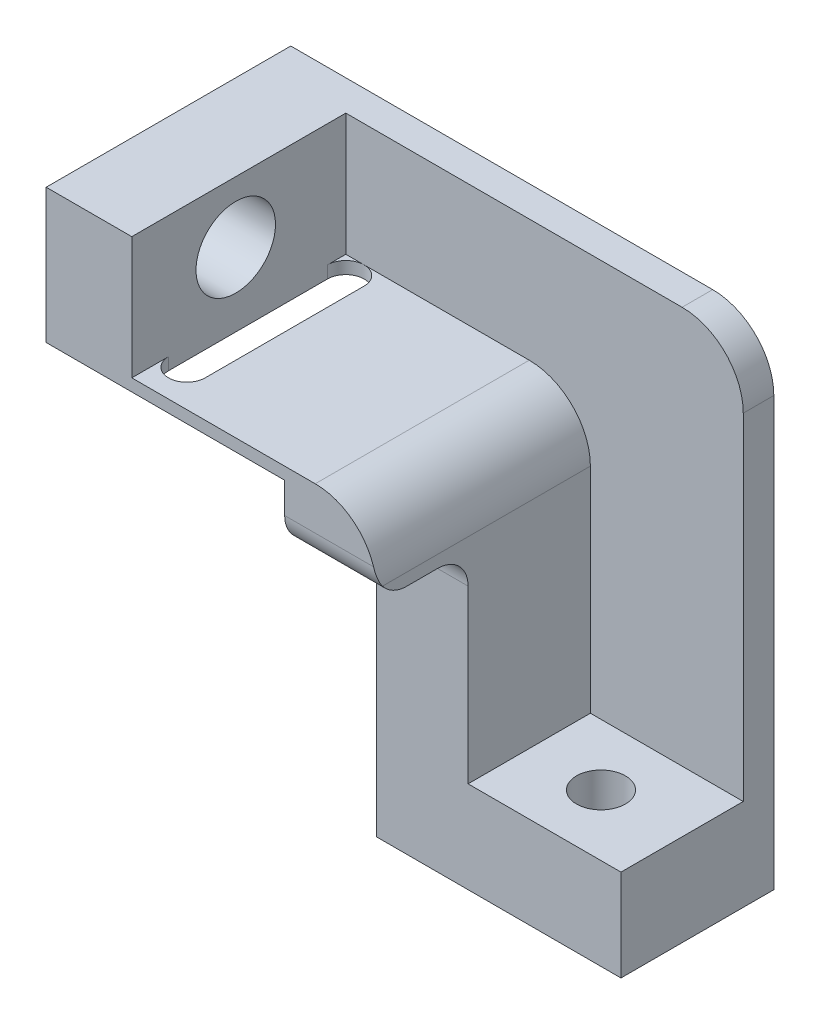
from build123d import *

# Parameters (mm, degrees)
BOSS_EXTRUDE1_DEPTH     = 40
SKETCH2_R               = 4
CUT_EXTRUDE1_DEPTH      = 30
CUT_EXTRUDE2_DEPTH      = 100
CUT_EXTRUDE2_DEPTH_BACK = 100
SKETCH3_R               = 6.5
SKETCH5_W               = 35
SKETCH5_H               = 20
CUT_EXTRUDE3_DEPTH      = 40
SKETCH6_W               = 5
SKETCH6_H               = 65
BOSS_EXTRUDE2_DEPTH     = 25
CUT_EXTRUDE4_DEPTH      = 10
FILLET1_R               = 10
SKETCH8_W               = 40
SKETCH8_H               = 48
CUT_EXTRUDE5_DEPTH      = 15
FILLET2_R               = 5


with BuildPart() as part:
    # Sketch1 → Boss-Extrude1 (new body)
    with BuildSketch(Plane.XY):
        Polygon((40, -23.325428286), (0, -23.325428286), (0, 34.674571714), (-39.002820891, 34.674571714), (-39.002820891, 56.674571714), (15, 56.674571714), (15, -8.325428286), (40, -8.325428286), align=None)
    extrude(amount=BOSS_EXTRUDE1_DEPTH)

    # Sketch2 → Cut-Extrude1 (cut)
    with BuildSketch(Plane(origin=(0, -8.325428286, 0), x_dir=(1, 0, 0), z_dir=(0, 1, 0))):
        with Locations((26.730150284, -15)):
            Circle(SKETCH2_R)
    extrude(amount=-CUT_EXTRUDE1_DEPTH, mode=Mode.SUBTRACT)

    # Sketch3 → Cut-Extrude2 (cut, two sides: drawn at the far end of the back side and taken through both)
    with BuildSketch(Plane(origin=(-39.002820891, 0, 0), x_dir=(0, 0, -1), z_dir=(1, 0, 0)).offset(-CUT_EXTRUDE2_DEPTH_BACK)):
        with Locations((-23, 46.674571714)):
            Circle(SKETCH3_R)
    extrude(amount=CUT_EXTRUDE2_DEPTH + CUT_EXTRUDE2_DEPTH_BACK, mode=Mode.SUBTRACT)

    # Sketch5 → Cut-Extrude3 (cut)
    with BuildSketch(Plane(origin=(15, 0, 0), x_dir=(0, 0, -1), z_dir=(1, 0, 0))):
        with Locations((-22.5, 46.674571714)):
            Rectangle(SKETCH5_W, SKETCH5_H)
    extrude(amount=-CUT_EXTRUDE3_DEPTH, mode=Mode.SUBTRACT)

    # Sketch6 → Boss-Extrude2 (add)
    with BuildSketch(Plane(origin=(15, 0, 0), x_dir=(0, 0, -1), z_dir=(1, 0, 0))):
        with Locations((-2.5, 24.174571714)):
            Rectangle(SKETCH6_W, SKETCH6_H)
    extrude(amount=BOSS_EXTRUDE2_DEPTH)

    # Sketch7 → Cut-Extrude4 (cut)
    with BuildSketch(Plane(origin=(0, 36.674571714, 0), x_dir=(1, 0, 0), z_dir=(0, 1, 0))):
        with BuildLine():
            Line((-19, -8), (-19, -34))
            ThreePointArc((-19, -34), (-22, -37), (-25, -34))
            Line((-25, -34), (-25, -8))
            ThreePointArc((-25, -8), (-22, -5), (-19, -8))
        make_face()
    extrude(amount=-CUT_EXTRUDE4_DEPTH, mode=Mode.SUBTRACT)

    # Fillet1
    fillet1_edges = [part.edges().sort_by_distance(p)[0] for p in [
        (15, 36.674571714, 22.5),
        (40, 56.674571714, 2.5),
    ]]
    fillet(fillet1_edges, radius=FILLET1_R)

    # Sketch8 → Cut-Extrude5 (cut)
    with BuildSketch(Plane.XY.offset(40)):
        with Locations((20, 0.674571714)):
            Rectangle(SKETCH8_W, SKETCH8_H)
    extrude(amount=-CUT_EXTRUDE5_DEPTH, mode=Mode.SUBTRACT)

    # Fillet2
    fillet2_edges = [part.edges().sort_by_distance(p)[0] for p in [
        (7.5, 24.674571714, 40),
        (7.5, 24.674571714, 25),
    ]]
    fillet(fillet2_edges, radius=FILLET2_R)


solid = part.part
